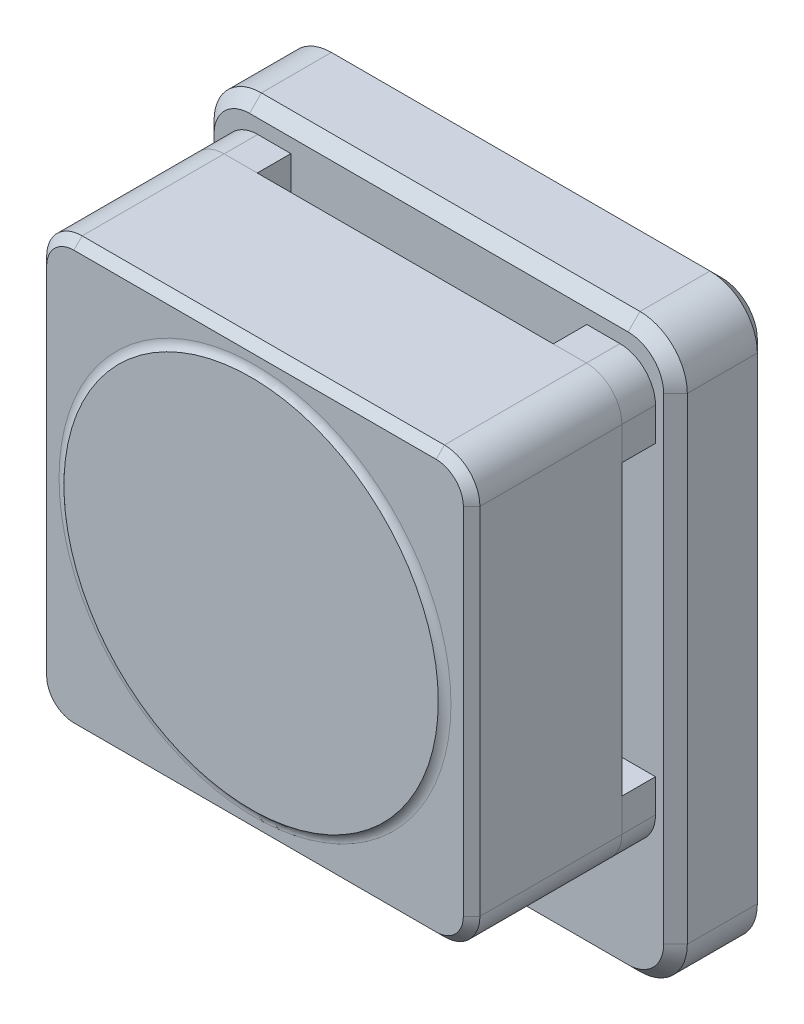
from build123d import *

# Parameters (mm, degrees)
BOSS_EXTRUDE1_DEPTH   = 12.7
SKETCH7_R             = 15.82
BOSS_EXTRUDE5_DEPTH   = 0.33
FILLET1_R             = 1
CHAMFER1_SIZE         = 0.7
BOSS_EXTRUDE6_DEPTH   = 2.84
BOSS_EXTRUDE6_2_DEPTH = 2.84
BOSS_EXTRUDE6_3_DEPTH = 2.84
BOSS_EXTRUDE6_4_DEPTH = 2.84
BOSS_EXTRUDE7_DEPTH   = 7.92
CHAMFER2_SIZE         = 1


with BuildPart() as part:
    # Sketch2 → Boss-Extrude1 (new body)
    with BuildSketch(Plane.XY):
        with BuildLine():
            Line((-15.31, -18), (15.31, -18))
            ThreePointArc((15.31, -18), (17.431320344, -17.121320344), (18.31, -15))
            Line((18.31, -15), (18.31, 15))
            ThreePointArc((18.31, 15), (17.431320344, 17.121320344), (15.31, 18))
            Line((15.31, 18), (-15.31, 18))
            ThreePointArc((-15.31, 18), (-17.431320344, 17.121320344), (-18.31, 15))
            Line((-18.31, 15), (-18.31, -15))
            ThreePointArc((-18.31, -15), (-17.431320344, -17.121320344), (-15.31, -18))
        make_face()
    extrude(amount=BOSS_EXTRUDE1_DEPTH)

    # Sketch7 → Boss-Extrude5 (add)
    with BuildSketch(Plane.XY.offset(12.7)):
        Circle(SKETCH7_R)
    extrude(amount=BOSS_EXTRUDE5_DEPTH)

    # Fillet1
    # the kernel refuses this fillet: 1 mm, written as the material it adds along each edge
    with BuildSketch(Plane(origin=(0, 0, 12.7), x_dir=(1, 0, 0), z_dir=(0, -1, 0))) as fillet1_piece_1:
        with BuildLine():
            CenterArc((16.562361098, 1), FILLET1_R, 222.067064802, 47.932935198)
            Line((15.82, 0.33), (15.805152778, 0.3166))
            ThreePointArc((15.805152778, 0.3166), (15.8, 0.165), (15.8, 0))
            Line((15.8, 0), (15.82, -0.02))
            Line((15.82, -0.02), (16.562361098, -0.02))
            Line((16.562361098, -0.02), (16.562361098, 0))
        make_face()
    revolve(axis=Axis((0, 0, 12.7), (0, 0, 1)))

    # Chamfer1
    chamfer1_edges = [part.edges().sort_by_distance(p)[0] for p in [
        (17.431320344, -17.121320344, 12.7),
        (18.31, 0, 12.7),
        (17.431320344, 17.121320344, 12.7),
        (0, 18, 12.7),
        (-17.431320344, 17.121320344, 12.7),
        (-18.31, 0, 12.7),
        (-17.431320344, -17.121320344, 12.7),
        (0, -18, 12.7),
    ]]
    chamfer(chamfer1_edges, length=CHAMFER1_SIZE)


with BuildPart() as body_2:
    # Sketch8 → Boss-Extrude6 (new body)
    with BuildSketch(Plane(origin=(0, 0, 0), x_dir=(-1, 0, 0), z_dir=(0, 0, -1))):
        with BuildLine():
            Line((-12.51, 12.2), (-18.31, 12.2))
            Line((-18.31, 12.2), (-18.31, 15))
            ThreePointArc((-18.31, 15), (-17.431320344, 17.121320344), (-15.31, 18))
            Line((-15.31, 18), (-12.51, 18))
            Line((-12.51, 18), (-12.51, 12.2))
        make_face()
    extrude(amount=BOSS_EXTRUDE6_DEPTH)



with BuildPart() as body_3:
    # Sketch8 → Boss-Extrude6 2 (new body)
    with BuildSketch(Plane(origin=(0, 0, 0), x_dir=(-1, 0, 0), z_dir=(0, 0, -1))):
        with BuildLine():
            Line((12.51, 18), (15.31, 18))
            ThreePointArc((15.31, 18), (17.431320344, 17.121320344), (18.31, 15))
            Line((18.31, 15), (18.31, 12.2))
            Line((18.31, 12.2), (12.51, 12.2))
            Line((12.51, 12.2), (12.51, 18))
        make_face()
    extrude(amount=BOSS_EXTRUDE6_2_DEPTH)


with BuildPart() as body_4:
    # Sketch8 → Boss-Extrude6 3 (new body)
    with BuildSketch(Plane(origin=(0, 0, 0), x_dir=(-1, 0, 0), z_dir=(0, 0, -1))):
        with BuildLine():
            Line((-12.51, -18), (-15.31, -18))
            ThreePointArc((-15.31, -18), (-17.431320344, -17.121320344), (-18.31, -15))
            Line((-18.31, -15), (-18.31, -12.2))
            Line((-18.31, -12.2), (-12.51, -12.2))
            Line((-12.51, -12.2), (-12.51, -18))
        make_face()
    extrude(amount=BOSS_EXTRUDE6_3_DEPTH)


with BuildPart() as body_5:
    # Sketch8 → Boss-Extrude6 4 (new body)
    with BuildSketch(Plane(origin=(0, 0, 0), x_dir=(-1, 0, 0), z_dir=(0, 0, -1))):
        with BuildLine():
            Line((12.51, -12.2), (12.51, -18))
            Line((12.51, -18), (15.31, -18))
            ThreePointArc((15.31, -18), (17.431320344, -17.121320344), (18.31, -15))
            Line((18.31, -15), (18.31, -12.2))
            Line((18.31, -12.2), (12.51, -12.2))
        make_face()
    extrude(amount=BOSS_EXTRUDE6_4_DEPTH)


with BuildPart() as body_2_1:
    add(body_2.part)

    add(body_3.part)  # Boss-Extrude7 merges body 3

    add(body_4.part)  # Boss-Extrude7 merges body 4

    add(body_5.part)  # Boss-Extrude7 merges body 5
    # Sketch9 → Boss-Extrude7 (add)
    with BuildSketch(Plane(origin=(0, 0, -2.84), x_dir=(-1, 0, 0), z_dir=(0, 0, -1))):
        with BuildLine():
            Line((-16, 20.2), (16, 20.2))
            ThreePointArc((16, 20.2), (18.828427125, 19.028427125), (20, 16.2))
            Line((20, 16.2), (20, -24.12))
            ThreePointArc((20, -24.12), (18.828427125, -26.948427125), (16, -28.12))
            Line((16, -28.12), (-16, -28.12))
            ThreePointArc((-16, -28.12), (-18.828427125, -26.948427125), (-20, -24.12))
            Line((-20, -24.12), (-20, 16.2))
            ThreePointArc((-20, 16.2), (-18.828427125, 19.028427125), (-16, 20.2))
        make_face()
    extrude(amount=BOSS_EXTRUDE7_DEPTH)

    # Chamfer2
    chamfer2_edges = [body_2_1.edges().sort_by_distance(p)[0] for p in [
        (18.828427125, -26.948427125, -2.84),
        (0, -28.12, -2.84),
        (-18.828427125, -26.948427125, -2.84),
        (-20, -3.96, -2.84),
        (-18.828427125, 19.028427125, -2.84),
        (0, 20.2, -2.84),
        (18.828427125, 19.028427125, -2.84),
        (20, -3.96, -2.84),
        (18.828427125, -26.948427125, -10.76),
        (0, -28.12, -10.76),
        (-18.828427125, -26.948427125, -10.76),
        (-20, -3.96, -10.76),
        (-18.828427125, 19.028427125, -10.76),
        (0, 20.2, -10.76),
        (18.828427125, 19.028427125, -10.76),
        (20, -3.96, -10.76),
    ]]
    chamfer(chamfer2_edges, length=CHAMFER2_SIZE)


solid = Compound([part.part, body_2_1.part])
